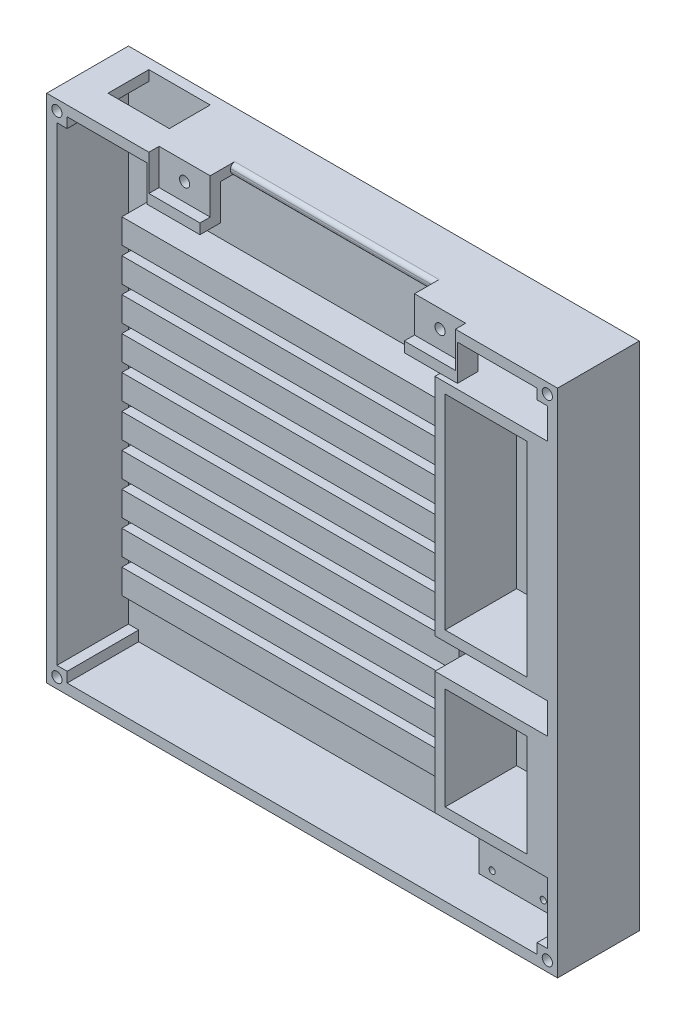
from build123d import *

# Parameters (mm, degrees)
SKETCH1_W                        = 250
SKETCH1_H                        = 250
BOSS_EXTRUDE1_DEPTH              = 50
SKETCH2_W                        = 40
SKETCH2_H                        = 100
SKETCH2_H_2                      = 50
CUT_EXTRUDE1_DEPTH               = 45
FILLET1_R                        = 5
FILLET2_R                        = 5
SKETCH5_R                        = 6.25
CUT_EXTRUDE2_DEPTH               = 22
FILLET5_R                        = 1.5
LPATTERN4_COUNT                  = 10
LPATTERN4_PITCH                  = 16.5
LPATTERN4_COUNT_DIR2             = 10
LPATTERN4_PITCH_DIR2             = 16.5
FILLET5_OF_LPATTERN4_R           = 1.5
CUT_EXTRUDE4_DEPTH               = 45
SKETCH8_W                        = 100
SKETCH8_H                        = 20
CUT_EXTRUDE5_DEPTH               = 20
FILLET6_R                        = 2.5
FILLET7_R                        = 2
SKETCH10_R                       = 13.5
CUT_EXTRUDE6_DEPTH               = 358.071421427
SKETCH4_W                        = 25
SKETCH4_H                        = 17.5
CUT_EXTRUDE7_DEPTH               = 10
VERRUNDUNG1_R                    = 2.5
SKIZZE2_W                        = 25
SKIZZE2_H                        = 5
AUFSATZ_LINEAR_AUSTRAGEN1_DEPTH  = 12.5
AUFSATZ_LINEAR_AUSTRAGEN2_DEPTH  = 10
SKIZZE11_W                       = 164
SKIZZE11_H                       = 164
SCHNITT_LINEAR_AUSTRAGEN6_DEPTH  = 10
SKIZZE12_W                       = 174
SKIZZE12_H                       = 174
SCHNITT_LINEAR_AUSTRAGEN7_DEPTH  = 2.5
SKIZZE13_R                       = 1.5
SCHNITT_LINEAR_AUSTRAGEN8_DEPTH  = 2.5
SKIZZE14_W                       = 10
SKIZZE14_H                       = 10
AUFSATZ_LINEAR_AUSTRAGEN3_DEPTH  = 45
SKIZZE16_W                       = 5
SKIZZE16_H                       = 250
SCHNITT_LINEAR_AUSTRAGEN9_DEPTH  = 358.071421427
SKIZZE18_R                       = 2.5
SCHNITT_LINEAR_AUSTRAGEN10_DEPTH = 10
SKIZZE21_W                       = 250
SKIZZE21_H                       = 250
SCHNITT_LINEAR_AUSTRAGEN13_DEPTH = 10
SKIZZE25_W                       = 250
SKIZZE25_H                       = 250
AUFSATZ_LINEAR_AUSTRAGEN7_DEPTH  = 5
SKIZZE26_W                       = 36
SKIZZE26_H                       = 28
SKIZZE26_R                       = 1.5
AUFSATZ_LINEAR_AUSTRAGEN8_DEPTH  = 20
SKIZZE27_W                       = 165
SKIZZE27_H                       = 12
AUFSATZ_LINEAR_AUSTRAGEN9_DEPTH  = 15
SKIZZE28_W                       = 30
SKIZZE28_H                       = 20
SCHNITT_LINEAR_AUSTRAGEN14_DEPTH = 15
SKIZZE29_R                       = 2.5
SCHNITT_LINEAR_AUSTRAGEN15_DEPTH = 15


with BuildPart() as part:
    # Sketch1 → Boss-Extrude1 (new body)
    with BuildSketch(Plane.XY):
        with Locations((-125, 125)):
            Rectangle(SKETCH1_W, SKETCH1_H)
    extrude(amount=BOSS_EXTRUDE1_DEPTH)

    # Sketch2 → Cut-Extrude1 (cut)
    with BuildSketch(Plane.XY.offset(50)):
        with Locations((-35, 170)):
            Rectangle(SKETCH2_W, SKETCH2_H)
        with Locations((-35, 70)):
            Rectangle(SKETCH2_W, SKETCH2_H_2)
    extrude(amount=-CUT_EXTRUDE1_DEPTH, mode=Mode.SUBTRACT)

    # Fillet1
    fillet1_edges = [part.edges().sort_by_distance(p)[0] for p in [
        (-55, 170, 50),
        (-35, 120, 50),
        (-15, 170, 50),
        (-35, 220, 50),
    ]]
    fillet(fillet1_edges, radius=FILLET1_R)

    # Fillet2
    fillet2_edges = [part.edges().sort_by_distance(p)[0] for p in [
        (-55, 70, 50),
        (-35, 45, 50),
        (-15, 70, 50),
        (-35, 95, 50),
    ]]
    fillet(fillet2_edges, radius=FILLET2_R)

    # Sketch5 → Cut-Extrude2 (cut)
    with BuildSketch(Plane.XY.offset(50)):
        with Locations((-225, 190)):
            Circle(SKETCH5_R)
    cut_extrude2 = extrude(amount=-CUT_EXTRUDE2_DEPTH, mode=Mode.SUBTRACT)

    # Fillet5
    fillet5_edges = [part.edges().sort_by_distance(p)[0] for p in [
        (-231.25, 190, 50),
    ]]
    fillet(fillet5_edges, radius=FILLET5_R)

    # LPattern4: Cut-Extrude2 10 × 10
    with Locations(*[(i * LPATTERN4_PITCH, -j * LPATTERN4_PITCH_DIR2, 0) for i in range(LPATTERN4_COUNT) for j in range(LPATTERN4_COUNT_DIR2) if (i, j) != (0, 0)]):
        add(cut_extrude2, mode=Mode.SUBTRACT)

    # Fillet5 of LPattern4
    fillet5_of_lpattern4_edges = [part.edges().sort_by_distance(p)[0] for p in [
        (-231.25, 173.5, 50),
        (-231.25, 157, 50),
        (-231.25, 140.5, 50),
        (-231.25, 124, 50),
        (-231.25, 107.5, 50),
        (-231.25, 91, 50),
        (-231.25, 74.5, 50),
        (-231.25, 58, 50),
        (-231.25, 41.5, 50),
        (-214.75, 190, 50),
        (-214.75, 173.5, 50),
        (-214.75, 157, 50),
        (-214.75, 140.5, 50),
        (-214.75, 124, 50),
        (-214.75, 107.5, 50),
        (-214.75, 91, 50),
        (-214.75, 74.5, 50),
        (-214.75, 58, 50),
        (-214.75, 41.5, 50),
        (-198.25, 190, 50),
        (-198.25, 173.5, 50),
        (-198.25, 157, 50),
        (-198.25, 140.5, 50),
        (-198.25, 124, 50),
        (-198.25, 107.5, 50),
        (-198.25, 91, 50),
        (-198.25, 74.5, 50),
        (-198.25, 58, 50),
        (-198.25, 41.5, 50),
        (-181.75, 190, 50),
        (-181.75, 173.5, 50),
        (-181.75, 157, 50),
        (-181.75, 140.5, 50),
        (-181.75, 124, 50),
        (-181.75, 107.5, 50),
        (-181.75, 91, 50),
        (-181.75, 74.5, 50),
        (-181.75, 58, 50),
        (-181.75, 41.5, 50),
        (-165.25, 190, 50),
        (-165.25, 173.5, 50),
        (-165.25, 157, 50),
        (-165.25, 140.5, 50),
        (-165.25, 124, 50),
        (-165.25, 107.5, 50),
        (-165.25, 91, 50),
        (-165.25, 74.5, 50),
        (-165.25, 58, 50),
        (-165.25, 41.5, 50),
        (-148.75, 190, 50),
        (-148.75, 173.5, 50),
        (-148.75, 157, 50),
        (-148.75, 140.5, 50),
        (-148.75, 124, 50),
        (-148.75, 107.5, 50),
        (-148.75, 91, 50),
        (-148.75, 74.5, 50),
        (-148.75, 58, 50),
        (-148.75, 41.5, 50),
        (-132.25, 190, 50),
        (-132.25, 173.5, 50),
        (-132.25, 157, 50),
        (-132.25, 140.5, 50),
        (-132.25, 124, 50),
        (-132.25, 107.5, 50),
        (-132.25, 91, 50),
        (-132.25, 74.5, 50),
        (-132.25, 58, 50),
        (-132.25, 41.5, 50),
        (-115.75, 190, 50),
        (-115.75, 173.5, 50),
        (-115.75, 157, 50),
        (-115.75, 140.5, 50),
        (-115.75, 124, 50),
        (-115.75, 107.5, 50),
        (-115.75, 91, 50),
        (-115.75, 74.5, 50),
        (-115.75, 58, 50),
        (-115.75, 41.5, 50),
        (-99.25, 190, 50),
        (-99.25, 173.5, 50),
        (-99.25, 157, 50),
        (-99.25, 140.5, 50),
        (-99.25, 124, 50),
        (-99.25, 107.5, 50),
        (-99.25, 91, 50),
        (-99.25, 74.5, 50),
        (-99.25, 58, 50),
        (-99.25, 41.5, 50),
        (-82.75, 190, 50),
        (-82.75, 173.5, 50),
        (-82.75, 157, 50),
        (-82.75, 140.5, 50),
        (-82.75, 124, 50),
        (-82.75, 107.5, 50),
        (-82.75, 91, 50),
        (-82.75, 74.5, 50),
        (-82.75, 58, 50),
        (-82.75, 41.5, 50),
    ]]
    fillet(fillet5_of_lpattern4_edges, radius=FILLET5_OF_LPATTERN4_R)

    # Sketch7 → Cut-Extrude4 (cut)
    with BuildSketch(Plane(origin=(0, 0, 0), x_dir=(-1, 0, 0), z_dir=(0, 0, -1))):
        Polygon((5, 245), (245, 245), (245, 5), (5, 5), (5, 40), (60, 40), (60, 100), (5, 100), (5, 115), (60, 115), (60, 225), (5, 225), align=None)
    extrude(amount=-CUT_EXTRUDE4_DEPTH, mode=Mode.SUBTRACT)

    # Sketch8 → Cut-Extrude5 (cut)
    with BuildSketch(Plane.XY.offset(50)):
        with Locations((-125, 240)):
            Rectangle(SKETCH8_W, SKETCH8_H)
    extrude(amount=-CUT_EXTRUDE5_DEPTH, mode=Mode.SUBTRACT)

    # Fillet6
    fillet6_edges = [part.edges().sort_by_distance(p)[0] for p in [
        (-125, 230, 45),
        (-125, 230, 50),
    ]]
    fillet(fillet6_edges, radius=FILLET6_R - 0.0001)  # a hair under: the kernel refuses the full size

    # Fillet7
    fillet7_edges = [part.edges().sort_by_distance(p)[0] for p in [
        (-125, 245, 30),
        (-125, 250, 30),
    ]]
    fillet(fillet7_edges, radius=FILLET7_R)

    # Sketch10 → Cut-Extrude6 (cut, through all)
    with BuildSketch(Plane.XY.offset(50)):
        with Locations((-35, 20)):
            Circle(SKETCH10_R)
    extrude(amount=-CUT_EXTRUDE6_DEPTH, mode=Mode.SUBTRACT)

    # Sketch4 → Cut-Extrude7 (cut)
    with BuildSketch(Plane.XY.offset(50)):
        with Locations((-187.5, 241.25)):
            Rectangle(SKETCH4_W, SKETCH4_H)
        with Locations((-62.5, 241.25)):
            Rectangle(SKETCH4_W, SKETCH4_H)
    extrude(amount=-CUT_EXTRUDE7_DEPTH, mode=Mode.SUBTRACT)

    # Verrundung1
    verrundung1_edges = [part.edges().sort_by_distance(p)[0] for p in [
        (-48.5, 20, 45),
        (-48.5, 20, 50),
    ]]
    fillet(verrundung1_edges, radius=VERRUNDUNG1_R - 0.0001)  # a hair under: the kernel refuses the full size

    # Skizze2 → Aufsatz-Linear austragen1 (add)
    with BuildSketch(Plane.XZ.offset(-245)):
        with Locations((-187.5, 37.5)):
            Rectangle(SKIZZE2_W, SKIZZE2_H)
        with Locations((-62.5, 37.5)):
            Rectangle(SKIZZE2_W, SKIZZE2_H)
    extrude(amount=AUFSATZ_LINEAR_AUSTRAGEN1_DEPTH)

    # Skizze4 → Aufsatz-Linear austragen2 (add)
    with BuildSketch(Plane(origin=(0, 0, 45), x_dir=(-1, 0, 0), z_dir=(0, 0, -1))):
        Polygon((50, 232.5), (75, 232.5), (75, 227.5), (49, 227.5), (49, 245), (50, 245), align=None)
        Polygon((200, 232.5), (175, 232.5), (175, 227.5), (201, 227.5), (201, 245), (200, 245), align=None)
    extrude(amount=AUFSATZ_LINEAR_AUSTRAGEN2_DEPTH)

    # Skizze11 → Schnitt-Linear austragen6 (cut)
    with BuildSketch(Plane.XY.offset(50)):
        with Locations((-150.75, 115.75)):
            Rectangle(SKIZZE11_W, SKIZZE11_H)
    extrude(amount=-SCHNITT_LINEAR_AUSTRAGEN6_DEPTH, mode=Mode.SUBTRACT)

    # Skizze12 → Schnitt-Linear austragen7 (cut)
    with BuildSketch(Plane.XY.offset(50)):
        with Locations((-150.75, 115.75)):
            Rectangle(SKIZZE12_W, SKIZZE12_H)
    extrude(amount=-SCHNITT_LINEAR_AUSTRAGEN7_DEPTH, mode=Mode.SUBTRACT)

    # Skizze13 → Schnitt-Linear austragen8 (cut)
    with BuildSketch(Plane.XY.offset(47.5)):
        with Locations((-235.25, 200.25)):
            Circle(SKIZZE13_R)
        with Locations((-150.75, 200.25)):
            Circle(SKIZZE13_R)
        with Locations((-66.25, 200.25)):
            Circle(SKIZZE13_R)
        with Locations((-235.25, 115.75)):
            Circle(SKIZZE13_R)
        with Locations((-66.25, 115.75)):
            Circle(SKIZZE13_R)
        with Locations(Location((-66.25, 31.25, 0), (0, 0, 180))):
            Circle(SKIZZE13_R)
        with Locations(Location((-150.75, 31.25, 0), (0, 0, 180))):
            Circle(SKIZZE13_R)
        with Locations(Location((-235.25, 31.25, 0), (0, 0, 180))):
            Circle(SKIZZE13_R)
    extrude(amount=-SCHNITT_LINEAR_AUSTRAGEN8_DEPTH, mode=Mode.SUBTRACT)

    # Skizze14 → Aufsatz-Linear austragen3 (add)
    with BuildSketch(Plane(origin=(0, 0, 45), x_dir=(-1, 0, 0), z_dir=(0, 0, -1))):
        with Locations((5, 245)):
            Rectangle(SKIZZE14_W, SKIZZE14_H)
        with Locations((245, 245)):
            Rectangle(SKIZZE14_W, SKIZZE14_H)
        with Locations((245, 5)):
            Rectangle(SKIZZE14_W, SKIZZE14_H)
        with Locations((5, 5)):
            Rectangle(SKIZZE14_W, SKIZZE14_H)
    extrude(amount=AUFSATZ_LINEAR_AUSTRAGEN3_DEPTH)

    # Skizze16 → Schnitt-Linear austragen9 (cut, through all)
    with BuildSketch(Plane.ZY.offset(250)):
        with Locations((47.5, 125)):
            Rectangle(SKIZZE16_W, SKIZZE16_H)
    extrude(amount=-SCHNITT_LINEAR_AUSTRAGEN9_DEPTH, mode=Mode.SUBTRACT)

    # Skizze18 → Schnitt-Linear austragen10 (cut)
    with BuildSketch(Plane.XY.offset(45)):
        with Locations((-245, 245)):
            Circle(SKIZZE18_R)
        with Locations((-5, 245)):
            Circle(SKIZZE18_R)
        with Locations((-5, 5)):
            Circle(SKIZZE18_R)
        with Locations((-245, 5)):
            Circle(SKIZZE18_R)
    extrude(amount=-SCHNITT_LINEAR_AUSTRAGEN10_DEPTH, mode=Mode.SUBTRACT)

    # Skizze21 → Schnitt-Linear austragen13 (cut)
    with BuildSketch(Plane(origin=(0, 0, 0), x_dir=(-1, 0, 0), z_dir=(0, 0, -1))):
        with Locations((125, 125)):
            Rectangle(SKIZZE21_W, SKIZZE21_H)
    extrude(amount=-SCHNITT_LINEAR_AUSTRAGEN13_DEPTH, mode=Mode.SUBTRACT)

    # Skizze25 → Aufsatz-Linear austragen7 (add)
    with BuildSketch(Plane(origin=(0, 0, 10), x_dir=(-1, 0, 0), z_dir=(0, 0, -1))):
        with Locations((125, 125)):
            Rectangle(SKIZZE25_W, SKIZZE25_H)
    extrude(amount=AUFSATZ_LINEAR_AUSTRAGEN7_DEPTH)

    # Skizze26 → Aufsatz-Linear austragen8 (add)
    with BuildSketch(Plane.XY.offset(10)):
        with Locations((-35.5, 24)):
            Rectangle(SKIZZE26_W, SKIZZE26_H)
        with Locations((-47, 33.5)):
            Circle(SKIZZE26_R, mode=Mode.SUBTRACT)
        with Locations((-22, 14.5)):
            Circle(SKIZZE26_R, mode=Mode.SUBTRACT)
        with Locations((-47, 14.5)):
            Circle(SKIZZE26_R, mode=Mode.SUBTRACT)
        with Locations((-22, 33.5)):
            Circle(SKIZZE26_R, mode=Mode.SUBTRACT)
    extrude(amount=AUFSATZ_LINEAR_AUSTRAGEN8_DEPTH)

    # Skizze27 → Aufsatz-Linear austragen9 (add)
    with BuildSketch(Plane.XY.offset(10)):
        with Locations((-150.75, 173.5)):
            Rectangle(SKIZZE27_W, SKIZZE27_H)
        with Locations((-150.75, 190)):
            Rectangle(SKIZZE27_W, SKIZZE27_H)
        with Locations((-150.75, 157)):
            Rectangle(SKIZZE27_W, SKIZZE27_H)
        with Locations((-150.75, 140.5)):
            Rectangle(SKIZZE27_W, SKIZZE27_H)
        with Locations((-150.75, 124)):
            Rectangle(SKIZZE27_W, SKIZZE27_H)
        with Locations((-150.75, 107.5)):
            Rectangle(SKIZZE27_W, SKIZZE27_H)
        with Locations((-150.75, 91)):
            Rectangle(SKIZZE27_W, SKIZZE27_H)
        with Locations((-150.75, 74.5)):
            Rectangle(SKIZZE27_W, SKIZZE27_H)
        with Locations((-150.75, 58)):
            Rectangle(SKIZZE27_W, SKIZZE27_H)
        with Locations((-150.75, 41.5)):
            Rectangle(SKIZZE27_W, SKIZZE27_H)
    extrude(amount=AUFSATZ_LINEAR_AUSTRAGEN9_DEPTH)

    # Skizze28 → Schnitt-Linear austragen14 (cut)
    with BuildSketch(Plane(origin=(0, 250, 0), x_dir=(1, 0, 0), z_dir=(0, 1, 0))):
        with Locations((-220, -20)):
            Rectangle(SKIZZE28_W, SKIZZE28_H)
    extrude(amount=-SCHNITT_LINEAR_AUSTRAGEN14_DEPTH, mode=Mode.SUBTRACT)

    # Skizze29 → Schnitt-Linear austragen15 (cut)
    with BuildSketch(Plane.XY.offset(40)):
        with Locations((-187.5, 241.25)):
            Circle(SKIZZE29_R)
        with Locations((-62.5, 241.25)):
            Circle(SKIZZE29_R)
    extrude(amount=-SCHNITT_LINEAR_AUSTRAGEN15_DEPTH, mode=Mode.SUBTRACT)


solid = part.part
